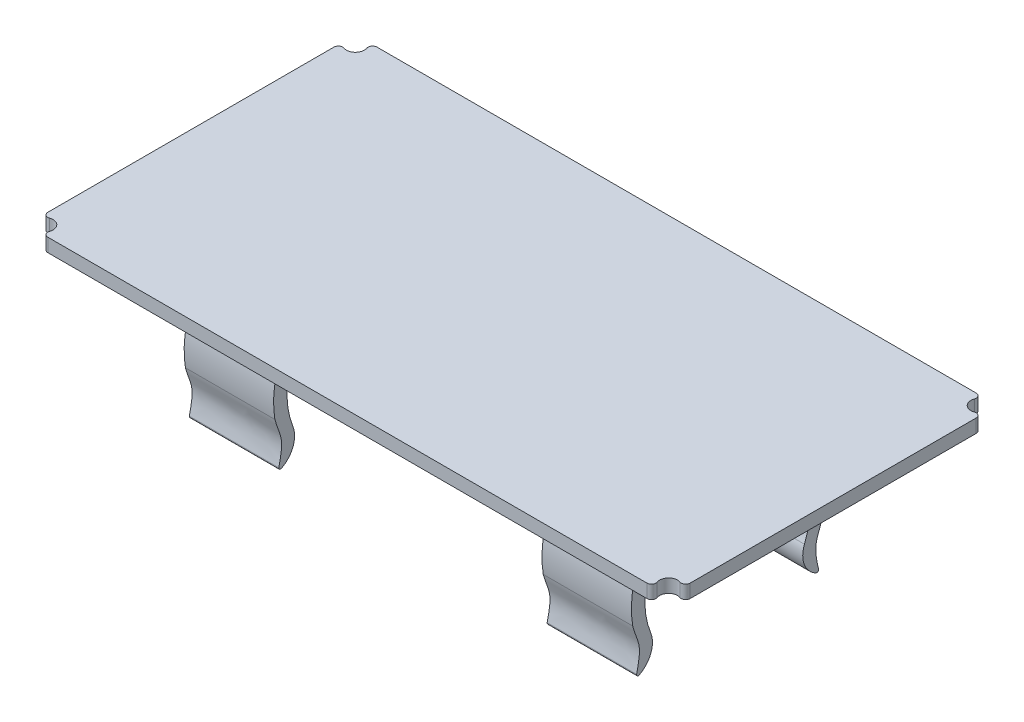
from build123d import *

# Parameters (mm, degrees)
BOSS_EXTRUDE1_DEPTH = 1.5
BOSS_EXTRUDE2_START = -10
BOSS_EXTRUDE2_DEPTH = 10
BOSS_EXTRUDE3_START = -50
BOSS_EXTRUDE3_DEPTH = 10
FILLET1_R           = 2


with BuildPart() as part:
    # Sketch1 → Boss-Extrude1 (new body)
    with BuildSketch(Plane(origin=(0, 0, 0), x_dir=(1, 0, 0), z_dir=(0, 1, 0))):
        with BuildLine():
            Line((2.414213562, 0), (69.385786438, 0))
            ThreePointArc((69.385786438, 0), (69.794034728, 0.211324865), (69.857190958, 0.666666667))
            ThreePointArc((69.857190958, 0.666666667), (70.092893219, 1.707106781), (71.133333333, 1.942809042))
            ThreePointArc((71.133333333, 1.942809042), (71.588675135, 2.005965272), (71.8, 2.414213562))
            Line((71.8, 2.414213562), (71.8, 34.385786438))
            ThreePointArc((71.8, 34.385786438), (71.588675135, 34.794034728), (71.133333333, 34.857190958))
            ThreePointArc((71.133333333, 34.857190958), (70.092893219, 35.092893219), (69.857190958, 36.133333333))
            ThreePointArc((69.857190958, 36.133333333), (69.794034728, 36.588675135), (69.385786438, 36.8))
            Line((69.385786438, 36.8), (2.414213562, 36.8))
            ThreePointArc((2.414213562, 36.8), (2.005965272, 36.588675135), (1.942809042, 36.133333333))
            ThreePointArc((1.942809042, 36.133333333), (1.707106781, 35.092893219), (0.666666667, 34.857190958))
            ThreePointArc((0.666666667, 34.857190958), (0.211324865, 34.794034728), (0, 34.385786438))
            Line((0, 34.385786438), (0, 2.414213562))
            ThreePointArc((0, 2.414213562), (0.211324865, 2.005965272), (0.666666667, 1.942809042))
            ThreePointArc((0.666666667, 1.942809042), (1.707106781, 1.707106781), (1.942809042, 0.666666667))
            ThreePointArc((1.942809042, 0.666666667), (2.005965272, 0.211324865), (2.414213562, 0))
        make_face()
    extrude(amount=BOSS_EXTRUDE1_DEPTH)

    # Sketch3 → Boss-Extrude2 (add)
    with BuildSketch(Plane.ZY.offset(BOSS_EXTRUDE2_START)):
        with BuildLine():
            Line((-13.368847051, 0), (-23.431152949, 0))
            ThreePointArc((-23.431152949, 0), (-28.03091883, -4.724238019), (-29.007394826, -11.245186236))
            add(Edge.make_bspline(
                [(-29.007394826, -11.245186236), (-28.91679643, -11.644865997), (-28.629408977, -12.351159485), (-28.070247469, -14.044000455), (-28.378426186, -15.242128196), (-28.569472033, -16.139362433)],
                knots=[0, 0, 0, 0, 0.314195915, 0.453997625, 1, 1, 1, 1], degree=3))
            ThreePointArc((-28.569472033, -16.139362433), (-28.490221034, -16.333239772), (-28.281450619, -16.350093766))
            ThreePointArc((-28.281450619, -16.350093766), (-26.972849776, -14.888720848), (-26.991683432, -12.927167314))
            ThreePointArc((-26.991683432, -12.927167314), (-18.4, -0.25), (-9.808316568, -12.927167314))
            ThreePointArc((-9.808316568, -12.927167314), (-9.827150224, -14.888720848), (-8.518549381, -16.350093766))
            ThreePointArc((-8.518549381, -16.350093766), (-8.309778966, -16.333239772), (-8.230527967, -16.139362433))
            add(Edge.make_bspline(
                [(-7.792605174, -11.245186236), (-7.88320357, -11.644865997), (-8.170591023, -12.351159485), (-8.729752531, -14.044000455), (-8.421573814, -15.242128196), (-8.230527967, -16.139362433)],
                knots=[0, 0, 0, 0, 0.314195915, 0.453997625, 1, 1, 1, 1], degree=3))
            ThreePointArc((-7.792605174, -11.245186236), (-8.76908117, -4.724238019), (-13.368847051, 0))
        make_face()
    extrude(amount=-BOSS_EXTRUDE2_DEPTH)

    # Sketch3<3> → Boss-Extrude3 (add)
    with BuildSketch(Plane.ZY.offset(BOSS_EXTRUDE3_START)):
        with BuildLine():
            Line((-23.431152949, 0), (-13.368847051, 0))
            ThreePointArc((-13.368847051, 0), (-8.76908117, -4.724238019), (-7.792605174, -11.245186236))
            add(Edge.make_bspline(
                [(-7.792605174, -11.245186236), (-7.88320357, -11.644865997), (-8.170591023, -12.351159485), (-8.729752531, -14.044000455), (-8.421573814, -15.242128196), (-8.230527967, -16.139362433)],
                knots=[0, 0, 0, 0, 0.314195915, 0.453997625, 1, 1, 1, 1], degree=3))
            ThreePointArc((-8.230527967, -16.139362433), (-8.309778966, -16.333239772), (-8.518549381, -16.350093766))
            ThreePointArc((-8.518549381, -16.350093766), (-9.827150224, -14.888720848), (-9.808316568, -12.927167314))
            ThreePointArc((-9.808316568, -12.927167314), (-18.4, -0.25), (-26.991683432, -12.927167314))
            ThreePointArc((-26.991683432, -12.927167314), (-26.972849776, -14.888720848), (-28.281450619, -16.350093766))
            ThreePointArc((-28.281450619, -16.350093766), (-28.490221034, -16.333239772), (-28.569472033, -16.139362433))
            add(Edge.make_bspline(
                [(-29.007394826, -11.245186236), (-28.91679643, -11.644865997), (-28.629408977, -12.351159485), (-28.070247469, -14.044000455), (-28.378426186, -15.242128196), (-28.569472033, -16.139362433)],
                knots=[0, 0, 0, 0, 0.314195915, 0.453997625, 1, 1, 1, 1], degree=3))
            ThreePointArc((-29.007394826, -11.245186236), (-28.03091883, -4.724238019), (-23.431152949, 0))
        make_face()
    extrude(amount=-BOSS_EXTRUDE3_DEPTH)

    # Fillet1
    fillet1_edges = [part.edges().sort_by_distance(p)[0] for p in [
        (55, 0, -23.431152949),
        (15, 0, -23.431152949),
        (55, 0, -13.368847051),
        (15, 0, -13.368847051),
    ]]
    fillet(fillet1_edges, radius=FILLET1_R)


solid = part.part
